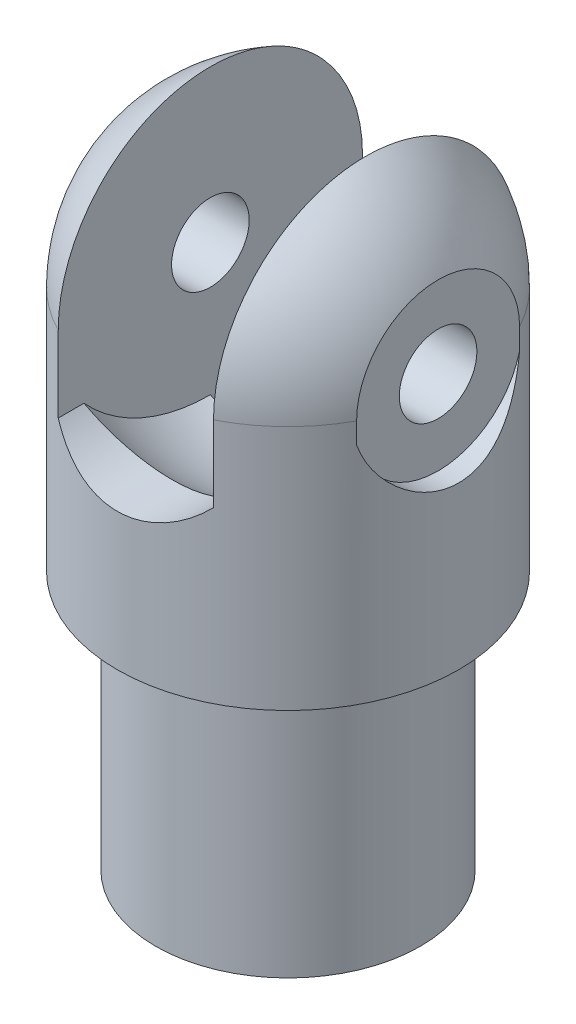
from build123d import *

# Parameters (mm, degrees)
SKETCH1_R               = 12.9921
BOSS_EXTRUDE1_DEPTH     = 25.4
CUT_EXTRUDE1_DEPTH      = 71.405666164
CUT_EXTRUDE1_DEPTH_BACK = 71.405666164
SKETCH3_R               = 3.81
CUT_REVOLVE1_ANGLE      = 270
CUT_REVOLVE2_ANGLE      = 270
SKETCH6_R               = 8.255
CUT_EXTRUDE2_DEPTH      = 2.032
CUT_EXTRUDE3_DEPTH      = 24.638


with BuildPart() as part:
    # Sketch1 → Boss-Extrude1 (new body)
    with BuildSketch(Plane(origin=(0, 0, 0), x_dir=(1, 0, 0), z_dir=(0, 1, 0))):
        Circle(SKETCH1_R)
    extrude(amount=BOSS_EXTRUDE1_DEPTH)

    # Sketch2 → Revolve1 (revolve)
    with BuildSketch(Plane(origin=(0, 0, 0), x_dir=(0, 0, -1), z_dir=(1, 0, 0))):
        with BuildLine():
            Line((-16.764, 25.4), (-16.764, 49.53))
            ThreePointArc((-16.764, 49.53), (-11.85393808, 61.38393808), (0, 66.294))
            Line((0, 66.294), (0, 25.4))
            Line((0, 25.4), (-16.764, 25.4))
        make_face()
    revolve(axis=Axis((0, 25.4, 0), (0, 1, 0)))

    # Sketch3 → Cut-Extrude1 (cut, two sides: drawn at the far end of the back side and taken through both)
    with BuildSketch(Plane(origin=(0, 0, 0), x_dir=(0, 0, -1), z_dir=(1, 0, 0)).offset(-CUT_EXTRUDE1_DEPTH_BACK)):
        with Locations((0, 49.53)):
            Circle(SKETCH3_R)
    extrude(amount=CUT_EXTRUDE1_DEPTH + CUT_EXTRUDE1_DEPTH_BACK, mode=Mode.SUBTRACT)

    # Sketch4 → Cut-Revolve1 (revolve, cut)
    with BuildSketch(Plane.XY):
        with BuildLine():
            Line((-7.62, 32.995439638), (-7.62, 49.53))
            Line((-7.62, 49.53), (7.62, 49.53))
            Line((7.62, 49.53), (7.62, 32.995439638))
            ThreePointArc((7.62, 32.995439638), (0, 31.32406453), (-7.62, 32.995439638))
        make_face()
    revolve(axis=Axis((-7.62, 49.53, 0), (1, 0, 0)), revolution_arc=CUT_REVOLVE1_ANGLE, mode=Mode.SUBTRACT)

    # Sketch5 → Cut-Revolve2 (revolve, cut)
    with BuildSketch(Plane.XY):
        with BuildLine():
            Line((7.62, 53.34), (-7.62, 53.34))
            Line((-7.62, 53.34), (-7.62, 36.575518946))
            ThreePointArc((-7.62, 36.575518946), (0, 34.925), (7.62, 36.575518946))
            Line((7.62, 36.575518946), (7.62, 53.34))
        make_face()
    revolve(axis=Axis((7.62, 53.34, 0), (-1, 0, 0)), revolution_arc=CUT_REVOLVE2_ANGLE, mode=Mode.SUBTRACT)

    # Sketch6 → Cut-Extrude2 (cut)
    with BuildSketch(Plane(origin=(16.764, 0, 0), x_dir=(0, 0, -1), z_dir=(1, 0, 0))):
        with Locations((0, 49.53)):
            Circle(SKETCH6_R)
    cut_extrude2 = extrude(amount=-CUT_EXTRUDE2_DEPTH, mode=Mode.SUBTRACT)

    # Mirror1: Cut-Extrude2 across plane
    add(cut_extrude2.mirror(Plane(origin=(0, 0, 0), x_dir=(0, 0, 1), z_dir=(1, 0, 0))), mode=Mode.SUBTRACT)

    # Sketch7 → Cut-Extrude3 (cut)
    with BuildSketch(Plane.XY):
        with BuildLine():
            Line((-7.62, 49.53), (-7.62, 42.063955264))
            ThreePointArc((-7.62, 42.063955264), (0, 38.862), (7.62, 42.063955264))
            Line((7.62, 42.063955264), (7.62, 49.53))
            Line((7.62, 49.53), (-7.62, 49.53))
        make_face()
    extrude(amount=CUT_EXTRUDE3_DEPTH, mode=Mode.SUBTRACT)


solid = part.part
